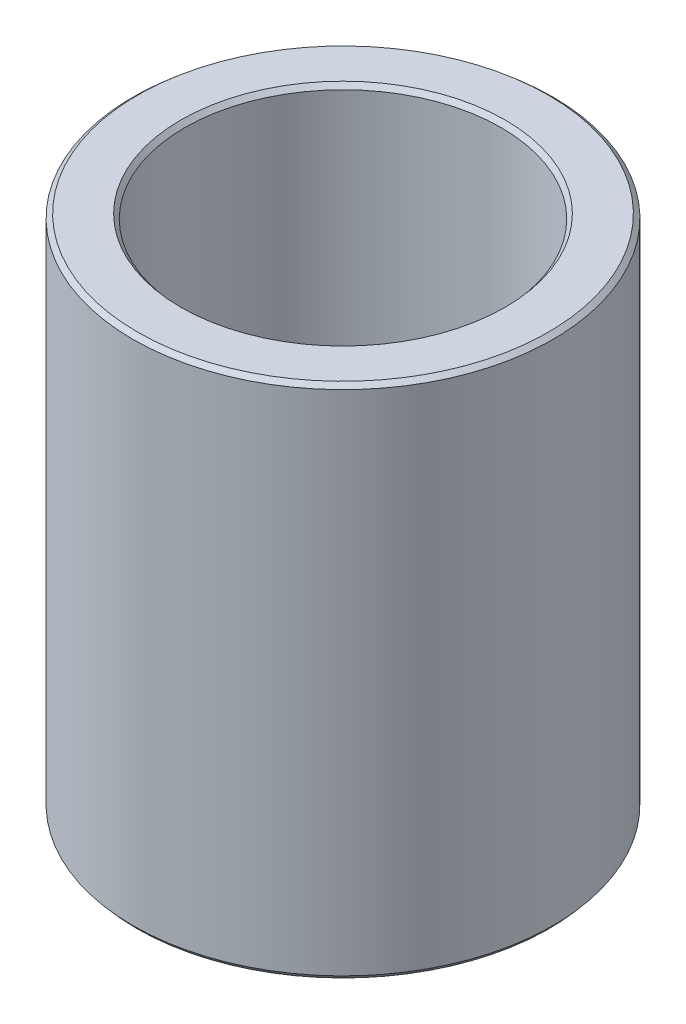
from build123d import *
from OCP.BRepFilletAPI import BRepFilletAPI_MakeChamfer

# Parameters (mm, degrees)
SKETCH1_R           = 42.5
BOSS_EXTRUDE1_DEPTH = 104.508108101
SKETCH2_R           = 32.030395739
CUT_EXTRUDE1_DEPTH  = 121.558884612
CHAMFER1_SIZE       = 0.803383835
CHAMFER1_SIZE2      = 0.93516907


with BuildPart() as part:
    # Sketch1 → Boss-Extrude1 (new body)
    with BuildSketch(Plane(origin=(0, 0, 0), x_dir=(1, 0, 0), z_dir=(0, 1, 0))):
        Circle(SKETCH1_R)
    extrude(amount=BOSS_EXTRUDE1_DEPTH)

    # Sketch2 → Cut-Extrude1 (cut, through all)
    with BuildSketch(Plane(origin=(0, 0, 0), x_dir=(1, 0, 0), z_dir=(0, 1, 0))):
        Circle(SKETCH2_R)
    extrude(amount=CUT_EXTRUDE1_DEPTH, mode=Mode.SUBTRACT)

    # Chamfer1: one chamfer whose edges measure the first distance from different faces: ONE call of the kernel's chamfer builder (chamfer() names one face for all edges)
    chamfer1_edges_1 = [part.edges().sort_by_distance(p)[0] for p in [
        (-32.030395739, 104.508108101, 0),
    ]]
    chamfer1_side_1 = [part.faces().sort_by_distance(p)[0] for p in [
        (-41.297918472, 104.508108101, 0),
    ]]
    chamfer1_edges_2 = [part.edges().sort_by_distance(p)[0] for p in [
        (-32.030395739, 0, 0),
    ]]
    chamfer1_side_2 = [part.faces().sort_by_distance(p)[0] for p in [
        (-32.030395739, 52.254054051, 0),
    ]]
    chamfer1_edges_3 = [part.edges().sort_by_distance(p)[0] for p in [
        (-42.5, 0, 0),
    ]]
    chamfer1_side_3 = [part.faces().sort_by_distance(p)[0] for p in [
        (-41.297918472, 0, 0),
    ]]
    chamfer1_edges_4 = [part.edges().sort_by_distance(p)[0] for p in [
        (-42.5, 104.508108101, 0),
    ]]
    chamfer1_side_4 = [part.faces().sort_by_distance(p)[0] for p in [
        (-42.5, 52.254054051, 0),
    ]]
    chamfer1 = BRepFilletAPI_MakeChamfer(part.part.solid().wrapped)
    for e in chamfer1_edges_1:
        chamfer1.Add(CHAMFER1_SIZE, CHAMFER1_SIZE2, e.wrapped, chamfer1_side_1[0].wrapped)  # the first distance lies on this face
    for e in chamfer1_edges_2:
        chamfer1.Add(CHAMFER1_SIZE, CHAMFER1_SIZE2, e.wrapped, chamfer1_side_2[0].wrapped)  # the first distance lies on this face
    for e in chamfer1_edges_3:
        chamfer1.Add(CHAMFER1_SIZE, CHAMFER1_SIZE2, e.wrapped, chamfer1_side_3[0].wrapped)  # the first distance lies on this face
    for e in chamfer1_edges_4:
        chamfer1.Add(CHAMFER1_SIZE, CHAMFER1_SIZE2, e.wrapped, chamfer1_side_4[0].wrapped)  # the first distance lies on this face
    add(Compound.cast(chamfer1.Shape()), mode=Mode.REPLACE)


solid = part.part
